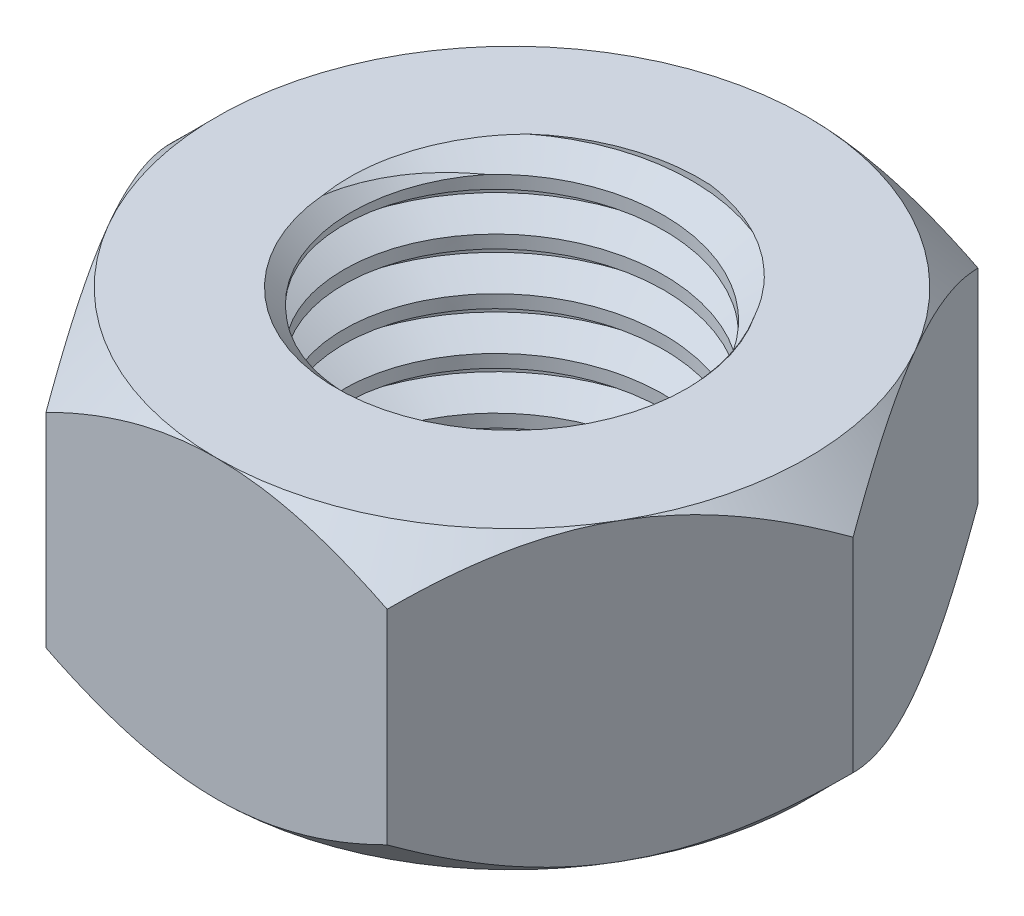
from build123d import *

# Parameters (mm, degrees)
BOSS_EXTRUDE4_DEPTH = 5
SKETCH4_OUTSIDE_W   = 51.524
SKETCH4_OUTSIDE_H   = 48.43
SKETCH4_OUTSIDE_R   = 10
CUT_EXTRUDE2_DEPTH  = 10
CUT_EXTRUDE2_TAPER  = 45
SKETCH5_R           = 5.425
CUT_EXTRUDE3_DEPTH  = 10
CHAMFER1_SIZE       = 0.5
THREAD1_PITCH       = 1.75


with BuildPart() as part:
    # Sketch1 → Boss-Extrude4 (new, symmetric)
    with BuildSketch(Plane(origin=(0, 0, 0), x_dir=(1, 0, 0), z_dir=(0, 1, 0))):
        Polygon((11.547005384, 0), (5.773502692, 10), (-5.773502692, 10), (-11.547005384, 0), (-5.773502692, -10), (5.773502692, -10), align=None)
    extrude(amount=BOSS_EXTRUDE4_DEPTH, both=True)

    # Sketch4 outside → Cut-Extrude2 (cut)
    with BuildSketch(Plane(origin=(0, 5, 0), x_dir=(1, 0, 0), z_dir=(0, 1, 0))):
        Rectangle(SKETCH4_OUTSIDE_W, SKETCH4_OUTSIDE_H)
        Circle(SKETCH4_OUTSIDE_R, mode=Mode.SUBTRACT)
    cut_extrude2 = extrude(amount=-CUT_EXTRUDE2_DEPTH, taper=CUT_EXTRUDE2_TAPER, mode=Mode.SUBTRACT)

    # Mirror2: Cut-Extrude2 across plane
    add(cut_extrude2.mirror(Plane.ZX), mode=Mode.SUBTRACT)

    # Sketch5 → Cut-Extrude3 (cut)
    with BuildSketch(Plane(origin=(0, 5, 0), x_dir=(1, 0, 0), z_dir=(0, 1, 0))):
        with Locations(Location((0, 0, 0), (0, 0, 270))):
            Circle(SKETCH5_R)
    extrude(amount=-CUT_EXTRUDE3_DEPTH, mode=Mode.SUBTRACT)

    # Chamfer1
    chamfer1_edges = [part.edges().sort_by_distance(p)[0] for p in [
        (0, -5, -5.425),
        (0, 5, -5.425),
    ]]
    chamfer(chamfer1_edges, length=CHAMFER1_SIZE)

    # Thread1: arcs per turn and ends read off the stored shape
    # Thread1: the profile of Thread Profile1 profile screwed along a right-hand helix through 10.857142 turns, 10 arcs to a turn; built about Z, then put on its axis
    thread1_z = Axis((0, 0, 0), (0, 0, 1))
    thread1_corners = [(5.4247, 0, -0.000173205), (6.372215281, 0, 0.546874998), (6.372215281, 0, 0.765624998), (5.4247, 0, 1.3126732)]
    with BuildLine(mode=Mode.PRIVATE) as thread1_profile:
        Line(thread1_corners[0], thread1_corners[1])
        Line(thread1_corners[1], thread1_corners[2])
        Line(thread1_corners[2], thread1_corners[3])
        Line(thread1_corners[3], thread1_corners[0])
    thread1_cap = Face(thread1_profile.wire())
    thread1_turn_angles = [0, 18, 36, 54, 72, 90, 108, 126, 144, 162, 180, 198, 216, 234, 252, 270, 288, 306, 324, 342, 360]
    thread1_turn_weights = [1, 0.9510565162951535, 1, 0.9510565162951535, 1, 0.9510565162951535, 1, 0.9510565162951535, 1, 0.9510565162951535, 1, 0.9510565162951535, 1, 0.9510565162951535, 1, 0.9510565162951535, 1, 0.9510565162951535, 1, 0.9510565162951535, 1]
    thread1_turn_rails = [Edge.make_bspline([Vector(p[0], p[1], 0).rotate(thread1_z, thread1_turn_angles[k]) / thread1_turn_weights[k] + Vector(0, 0, p[2] + THREAD1_PITCH * thread1_turn_angles[k] / 360) for k in range(21)], [0, 0, 0, 1, 1, 2, 2, 3, 3, 4, 4, 5, 5, 6, 6, 7, 7, 8, 8, 9, 9, 10, 10, 10], 2, thread1_turn_weights) for p in thread1_corners]
    thread1_turn_sides = [Face.make_surface_from_curves(thread1_turn_rails[p[0]], thread1_turn_rails[p[1]]) for p in [(0, 1), (1, 2), (2, 3), (3, 0)]]
    thread1_last_angles = [3600, 3618, 3636, 3654, 3672, 3690, 3708, 3726, 3744, 3762, 3780, 3798, 3816, 3834, 3852, 3870, 3888, 3898.2855, 3908.571]
    thread1_last_weights = [1, 0.9510565162951535, 1, 0.9510565162951535, 1, 0.9510565162951535, 1, 0.9510565162951535, 1, 0.9510565162951535, 1, 0.9510565162951535, 1, 0.9510565162951535, 1, 0.9510565162951535, 1, 0.9839302563929734, 1]
    thread1_last_rails = [Edge.make_bspline([Vector(p[0], p[1], 0).rotate(thread1_z, thread1_last_angles[k]) / thread1_last_weights[k] + Vector(0, 0, p[2] + THREAD1_PITCH * thread1_last_angles[k] / 360) for k in range(19)], [0, 0, 0, 1, 1, 2, 2, 3, 3, 4, 4, 5, 5, 6, 6, 7, 7, 8, 8, 9, 9, 9], 2, thread1_last_weights) for p in thread1_corners]
    thread1_last_sides = [Face.make_surface_from_curves(thread1_last_rails[p[0]], thread1_last_rails[p[1]]) for p in [(0, 1), (1, 2), (2, 3), (3, 0)]]
    thread1 = Plane(origin=(0, 9.5, 0), x_dir=(-1, 0, 0), z_dir=(0, -1, 0)) * Solid(Shell([*[p.moved(Location((0, 0, THREAD1_PITCH * i))) for i in range(10) for p in thread1_turn_sides], *thread1_last_sides, thread1_cap, thread1_cap.rotate(thread1_z, 3908.571).moved(Location((0, 0, THREAD1_PITCH * 3908.571 / 360)))]))
    add(thread1, mode=Mode.SUBTRACT)


solid = part.part
